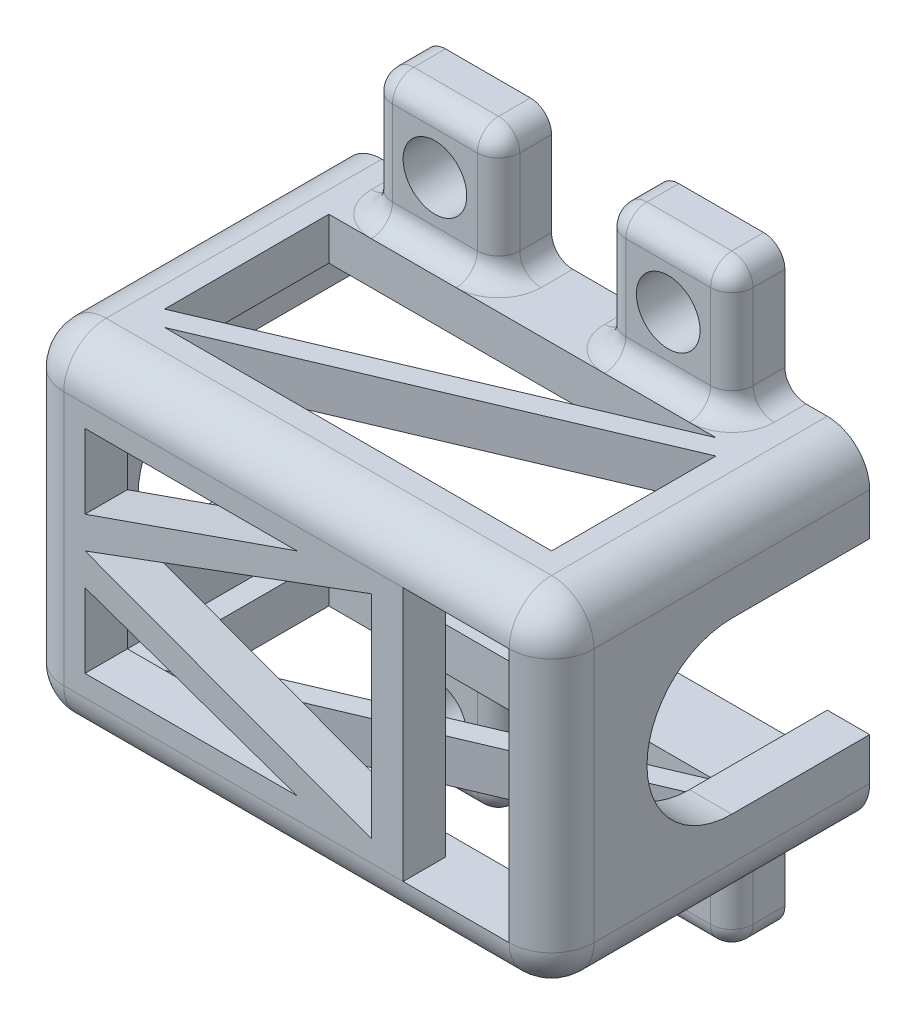
from build123d import *

# Parameters (mm, degrees)
CROQUIS1_W              = 23
CROQUIS1_H              = 16
SALIENTE_EXTRUIR1_DEPTH = 15
CROQUIS2_W              = 11
CROQUIS2_H              = 12
CORTAR_EXTRUIR1_DEPTH   = 21
CORTAR_EXTRUIR2_DEPTH   = 23
CROQUIS5_W              = 5
CROQUIS5_H              = 12
CORTAR_EXTRUIR3_DEPTH   = 2
REDONDEO1_R             = 2
CORTAR_EXTRUIR4_DEPTH   = 32.780497164
CROQUIS18_W             = 21
CROQUIS18_H             = 12
CORTAR_EXTRUIR8_DEPTH   = 31.886890423
CROQUIS17_W             = 15
CROQUIS17_H             = 16
SALIENTE_EXTRUIR7_DEPTH = 2
REDONDEO8_R             = 2
CROQUIS19_W             = 6
CROQUIS19_H             = 2.5
SALIENTE_EXTRUIR8_DEPTH = 6
CROQUIS20_W             = 6
CROQUIS20_H             = 2.5
SALIENTE_EXTRUIR9_DEPTH = 6
CROQUIS21_R             = 1.5
CORTAR_EXTRUIR9_DEPTH   = 36.570352824
REDONDEO9_R             = 1
CORTAR_EXTRUIR10_DEPTH  = 16
CORTAR_EXTRUIR11_DEPTH  = 2


with BuildPart() as part:
    # Croquis1 → Saliente-Extruir1 (new body)
    with BuildSketch(Plane.XY):
        with Locations((11.5, 8)):
            Rectangle(CROQUIS1_W, CROQUIS1_H)
    extrude(amount=SALIENTE_EXTRUIR1_DEPTH)

    # Croquis2 → Cortar-Extruir1 (cut)
    with BuildSketch(Plane(origin=(23, 0, 0), x_dir=(0, 0, -1), z_dir=(1, 0, 0))):
        with Locations((-7.5, 8)):
            Rectangle(CROQUIS2_W, CROQUIS2_H)
    extrude(amount=-CORTAR_EXTRUIR1_DEPTH, mode=Mode.SUBTRACT)

    # Croquis4 → Cortar-Extruir2 (cut)
    with BuildSketch(Plane.ZY):
        with BuildLine():
            Line((7.5, 12), (0, 12))
            Line((0, 12), (0, 4))
            Line((0, 4), (7.5, 4))
            ThreePointArc((7.5, 4), (11.5, 8), (7.5, 12))
        make_face()
    extrude(amount=-CORTAR_EXTRUIR2_DEPTH, mode=Mode.SUBTRACT)

    # Croquis5 → Cortar-Extruir3 (cut)
    with BuildSketch(Plane.XY.offset(15)):
        with Locations((20.5, 8)):
            Rectangle(CROQUIS5_W, CROQUIS5_H)
    extrude(amount=-CORTAR_EXTRUIR3_DEPTH, mode=Mode.SUBTRACT)

    # Redondeo1
    redondeo1_edges = [part.edges().sort_by_distance(p)[0] for p in [
        (11.5, 16, 15),
        (11.5, 0, 15),
        (0, 16, 7.5),
        (0, 8, 15),
        (0, 0, 7.5),
    ]]
    fillet(redondeo1_edges, radius=REDONDEO1_R)

    # Croquis8 → Cortar-Extruir4 (cut, through all)
    with BuildSketch(Plane.XY.offset(15)):
        Polygon((16.5, 3), (16.5, 13), (3, 8), align=None)
        Polygon((3, 6.500458737), (3, 3), (13, 3), align=None)
        Polygon((3, 9.5), (3, 13), (13, 13), align=None)
    extrude(amount=-CORTAR_EXTRUIR4_DEPTH, mode=Mode.SUBTRACT)

    # Croquis18 → Cortar-Extruir8 (cut, through all)
    with BuildSketch(Plane.XY.offset(2)):
        with Locations((12.5, 8)):
            Rectangle(CROQUIS18_W, CROQUIS18_H)
    extrude(amount=-CORTAR_EXTRUIR8_DEPTH, mode=Mode.SUBTRACT)

    # Croquis17 → Saliente-Extruir7 (add)
    with BuildSketch(Plane(origin=(23, 0, 0), x_dir=(0, 0, -1), z_dir=(1, 0, 0))):
        with Locations((-7.5, 8)):
            Rectangle(CROQUIS17_W, CROQUIS17_H)
    extrude(amount=SALIENTE_EXTRUIR7_DEPTH)

    # Redondeo8
    # the kernel refuses this fillet: 2 mm, written as the material it takes off along each edge
    with BuildSketch(Plane(origin=(23, 14, 13), x_dir=(1, 0, 0), z_dir=(0, 1, 0))) as redondeo8_piece_1_section:
        Polygon((0, 0), (REDONDEO8_R * 1.02, 0), (REDONDEO8_R * 1.02, -REDONDEO8_R * 1.02), (0, -REDONDEO8_R * 1.02), align=None)
    redondeo8_piece_1 = extrude(amount=REDONDEO8_R * 1.02, mode=Mode.PRIVATE)
    redondeo8_piece_1 = redondeo8_piece_1 - Plane(origin=(23, 14, 13), x_dir=(-0.7071067811865475, 0, -0.7071067811865475), z_dir=(0, 1, 0)) * Sphere(REDONDEO8_R, mode=Mode.PRIVATE)
    add(redondeo8_piece_1, mode=Mode.SUBTRACT)
    with BuildSketch(Plane(origin=(23, 2, 13), x_dir=(1, 0, 0), z_dir=(0, -1, 0))) as redondeo8_piece_2_section:
        Polygon((0, 0), (REDONDEO8_R * 1.02, 0), (REDONDEO8_R * 1.02, REDONDEO8_R * 1.02), (0, REDONDEO8_R * 1.02), align=None)
    redondeo8_piece_2 = extrude(amount=REDONDEO8_R * 1.02, mode=Mode.PRIVATE)
    redondeo8_piece_2 = redondeo8_piece_2 - Plane(origin=(23, 2, 13), x_dir=(-0.7071067811865475, 0, -0.7071067811865475), z_dir=(0, -1, 0)) * Sphere(REDONDEO8_R, mode=Mode.PRIVATE)
    add(redondeo8_piece_2, mode=Mode.SUBTRACT)
    with BuildSketch(Plane(origin=(23, 14, 15), x_dir=(0, 0, -1), z_dir=(0, 1, 0))) as redondeo8_piece_3_section:
        with BuildLine():
            CenterArc((REDONDEO8_R, -REDONDEO8_R), REDONDEO8_R, 90, 90)
            Line((0, -REDONDEO8_R), (0, 0))
            Line((0, 0), (REDONDEO8_R, 0))
        make_face()
    redondeo8_piece_3 = extrude(amount=7, mode=Mode.PRIVATE)
    redondeo8_piece_3 = redondeo8_piece_3 - Plane(origin=(23.57115566, 14, 13), x_dir=(0, 0, 1), z_dir=(-1, 0, 0)) * Cylinder(2, 23, mode=Mode.PRIVATE)
    add(redondeo8_piece_3, mode=Mode.SUBTRACT)
    with BuildSketch(Plane(origin=(23, -5, 15), x_dir=(1, 0, 0), z_dir=(0, 1, 0))) as redondeo8_piece_4_section:
        with BuildLine():
            CenterArc((REDONDEO8_R, REDONDEO8_R), REDONDEO8_R, 180, 90)
            Line((0, REDONDEO8_R), (0, 0))
            Line((0, 0), (REDONDEO8_R, 0))
        make_face()
    redondeo8_piece_4 = extrude(amount=7, mode=Mode.PRIVATE)
    redondeo8_piece_4 = redondeo8_piece_4 - Plane(origin=(23.571155663, 2, 13), x_dir=(0, -1, 0), z_dir=(1, 0, 0)) * Cylinder(2, 22, mode=Mode.PRIVATE)
    add(redondeo8_piece_4, mode=Mode.SUBTRACT)
    with BuildSketch(Plane(origin=(25, 16, 13), x_dir=(-1, 0, 0), z_dir=(0, 0, -1)), Plane(origin=(25, 0, -5), x_dir=(-1, 0, 0), z_dir=(0, 0, 1))) as redondeo8_piece_5:
        with BuildLine():
            CenterArc((REDONDEO8_R, -REDONDEO8_R), REDONDEO8_R, 90, 90)
            Line((0, -REDONDEO8_R), (0, 0))
            Line((0, 0), (REDONDEO8_R, 0))
        make_face()
    extrude(amount=18, mode=Mode.SUBTRACT)
    with BuildSketch(Plane(origin=(25, 2, 15), x_dir=(0, 0, -1), z_dir=(0, 1, 0))) as redondeo8_piece_6:
        with BuildLine():
            CenterArc((REDONDEO8_R, REDONDEO8_R), REDONDEO8_R, 180, 90)
            Line((0, REDONDEO8_R), (0, 0))
            Line((0, 0), (REDONDEO8_R, 0))
        make_face()
    extrude(amount=12, mode=Mode.SUBTRACT)

    # Croquis19 → Saliente-Extruir8 (add)
    with BuildSketch(Plane(origin=(0, 16, 0), x_dir=(1, 0, 0), z_dir=(0, 1, 0))):
        with Locations((18, -1.25)):
            Rectangle(CROQUIS19_W, CROQUIS19_H)
        with Locations((7, -1.25)):
            Rectangle(CROQUIS19_W, CROQUIS19_H)
    extrude(amount=SALIENTE_EXTRUIR8_DEPTH)

    # Croquis20 → Saliente-Extruir9 (add)
    with BuildSketch(Plane.XZ):
        with Locations((7, 1.25)):
            Rectangle(CROQUIS20_W, CROQUIS20_H)
        with Locations((18, 1.25)):
            Rectangle(CROQUIS20_W, CROQUIS20_H)
    extrude(amount=SALIENTE_EXTRUIR9_DEPTH)

    # Croquis21 → Cortar-Extruir9 (cut, through all)
    with BuildSketch(Plane.XY.offset(2.5)):
        with Locations((18, 19)):
            Circle(CROQUIS21_R)
        with Locations((7, 19)):
            Circle(CROQUIS21_R)
        with Locations((7, -3)):
            Circle(CROQUIS21_R)
        with Locations((18, -3)):
            Circle(CROQUIS21_R)
    extrude(amount=-CORTAR_EXTRUIR9_DEPTH, mode=Mode.SUBTRACT)

    # Redondeo9
    redondeo9_edges = [part.edges().sort_by_distance(p)[0] for p in [
        (21, 16, 1.25),
        (21, 19, 2.5),
        (15, 16, 1.25),
        (18, 16, 2.5),
        (15, 19, 2.5),
        (21, 22, 1.25),
        (15, 22, 1.25),
        (18, 22, 2.5),
        (4, 16, 1.25),
        (7, 16, 2.5),
        (4, 19, 2.5),
        (10, 16, 1.25),
        (10, 19, 2.5),
        (4, 22, 1.25),
        (7, 22, 2.5),
        (10, 22, 1.25),
        (4, 0, 1.25),
        (4, -3, 2.5),
        (10, 0, 1.25),
        (7, 0, 2.5),
        (10, -3, 2.5),
        (4, -6, 1.25),
        (10, -6, 1.25),
        (7, -6, 2.5),
        (21, 0, 1.25),
        (18, 0, 2.5),
        (21, -3, 2.5),
        (15, 0, 1.25),
        (15, -3, 2.5),
        (21, -6, 1.25),
        (18, -6, 2.5),
        (15, -6, 1.25),
    ]]
    fillet(redondeo9_edges, radius=REDONDEO9_R)

    # Croquis22 → Cortar-Extruir10 (cut)
    with BuildSketch(Plane.XZ):
        Polygon((3, 11.25), (21.25, 3.5), (3, 3.5), align=None)
        Polygon((22, 4.25), (3.75, 12), (22, 12), align=None)
    extrude(amount=-CORTAR_EXTRUIR10_DEPTH, mode=Mode.SUBTRACT)

    # Croquis23 → Cortar-Extruir11 (cut)
    with BuildSketch(Plane(origin=(25, 0, 0), x_dir=(0, 0, -1), z_dir=(1, 0, 0))):
        with BuildLine():
            Line((0, 4), (0, 12))
            Line((0, 12), (-6.5, 12))
            ThreePointArc((-6.5, 12), (-10.5, 8), (-6.5, 4))
            Line((-6.5, 4), (0, 4))
        make_face()
    extrude(amount=-CORTAR_EXTRUIR11_DEPTH, mode=Mode.SUBTRACT)


solid = part.part
